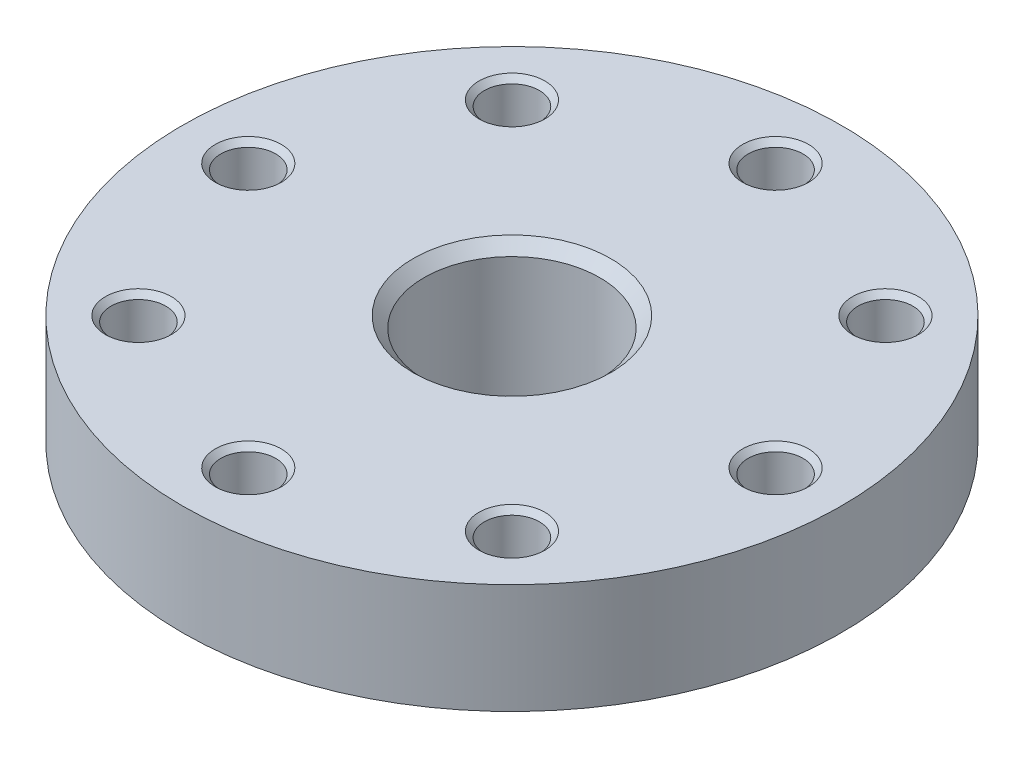
from build123d import *

# Parameters (mm, degrees)
SKETCH1_R           = 15
BOSS_EXTRUDE1_DEPTH = 5
SKETCH2_R           = 1.25
CUT_EXTRUDE1_DEPTH  = 22.794494718
SKETCH3_R           = 6
BOSS_EXTRUDE2_DEPTH = 1.5
SKETCH4_R           = 1.5
CUT_EXTRUDE2_DEPTH  = 1.5
CHAMFER5_SIZE       = 0.25
SKETCH5_R           = 4
CUT_EXTRUDE3_DEPTH  = 6
CHAMFER7_SIZE       = 0.5


with BuildPart() as part:
    # Sketch1 → Boss-Extrude1 (new body)
    with BuildSketch(Plane(origin=(0, 0, 0), x_dir=(1, 0, 0), z_dir=(0, 1, 0))):
        Circle(SKETCH1_R)
    extrude(amount=BOSS_EXTRUDE1_DEPTH)

    # Sketch2 → Cut-Extrude1 (cut, through all)
    with BuildSketch(Plane(origin=(0, 5, 0), x_dir=(1, 0, 0), z_dir=(0, 1, 0))):
        with Locations((0, 12)):
            Circle(SKETCH2_R)
        with Locations((-12, 0)):
            Circle(SKETCH2_R)
        with Locations((0, -12)):
            Circle(SKETCH2_R)
        with Locations((12, 0)):
            Circle(SKETCH2_R)
        with Locations((-8.5, 8.5)):
            Circle(SKETCH2_R)
        with Locations((-8.5, -8.5)):
            Circle(SKETCH2_R)
        with Locations((8.5, 8.5)):
            Circle(SKETCH2_R)
        with Locations((8.5, -8.5)):
            Circle(SKETCH2_R)
    extrude(amount=-CUT_EXTRUDE1_DEPTH, mode=Mode.SUBTRACT)

    # Sketch3 → Boss-Extrude2 (add)
    with BuildSketch(Plane(origin=(0, 0, 0), x_dir=(1, 0, 0), z_dir=(0, 1, 0))):
        Circle(SKETCH3_R)
    extrude(amount=-BOSS_EXTRUDE2_DEPTH)

    # Sketch4 → Cut-Extrude2 (cut)
    with BuildSketch(Plane.XZ.offset(1.5)):
        Circle(SKETCH4_R)
    extrude(amount=-CUT_EXTRUDE2_DEPTH, mode=Mode.SUBTRACT)

    # Chamfer5
    chamfer5_edges = [part.edges().sort_by_distance(p)[0] for p in [
        (-13.25, 0, 0),
        (-9.75, 0, -8.5),
        (-1.25, 0, -12),
        (7.25, 0, -8.5),
        (10.75, 0, 0),
        (7.25, 0, 8.5),
        (-1.25, 0, 12),
        (-9.75, 0, 8.5),
        (7.25, 5, -8.5),
        (-1.25, 5, -12),
        (-9.75, 5, -8.5),
        (-13.25, 5, 0),
        (-9.75, 5, 8.5),
        (-1.25, 5, 12),
        (7.25, 5, 8.5),
        (10.75, 5, 0),
    ]]
    chamfer(chamfer5_edges, length=CHAMFER5_SIZE)

    # Sketch5 → Cut-Extrude3 (cut)
    with BuildSketch(Plane(origin=(0, 5, 0), x_dir=(1, 0, 0), z_dir=(0, 1, 0))):
        Circle(SKETCH5_R)
    extrude(amount=-CUT_EXTRUDE3_DEPTH, mode=Mode.SUBTRACT)

    # Chamfer7
    chamfer7_edges = [part.edges().sort_by_distance(p)[0] for p in [
        (-4, 5, 0),
    ]]
    chamfer(chamfer7_edges, length=CHAMFER7_SIZE)


solid = part.part
